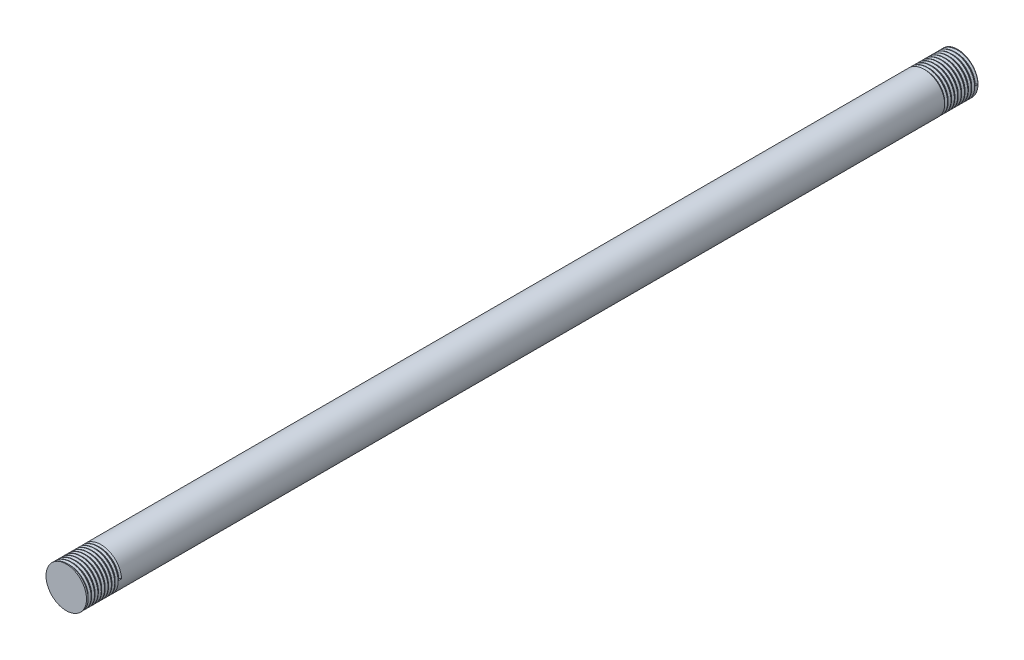
from build123d import *

# Parameters (mm, degrees)
SKETCH1_R           = 7.5
BOSS_EXTRUDE1_DEPTH = 330.2
THREAD4_PITCH       = 1.25
THREAD5_PITCH       = 1.25


with BuildPart() as part:
    # Sketch1 → Boss-Extrude1 (new body)
    with BuildSketch(Plane.XY):
        Circle(SKETCH1_R)
    extrude(amount=BOSS_EXTRUDE1_DEPTH)

    # Thread4: the profile of Thread Profile4 profile screwed along a right-hand helix of 9.5 turns, 8 arcs to a turn; built about Z, then put on its axis
    thread4_z = Axis((0, 0, 0), (0, 0, 1))
    thread4_corners = [(7.5003, 0, -0.000173205), (7.5003, 0, 1.093923202), (6.823417656, 0, 0.703124998), (6.823417656, 0, 0.390624998)]
    with BuildLine(mode=Mode.PRIVATE) as thread4_profile:
        Line(thread4_corners[0], thread4_corners[1])
        Line(thread4_corners[1], thread4_corners[2])
        Line(thread4_corners[2], thread4_corners[3])
        Line(thread4_corners[3], thread4_corners[0])
    thread4_cap = Face(thread4_profile.wire())
    thread4_turn_angles = [0, 22.5, 45, 67.5, 90, 112.5, 135, 157.5, 180, 202.5, 225, 247.5, 270, 292.5, 315, 337.5, 360]
    thread4_turn_weights = [1, 0.9238795325112867, 1, 0.9238795325112867, 1, 0.9238795325112867, 1, 0.9238795325112867, 1, 0.9238795325112867, 1, 0.9238795325112867, 1, 0.9238795325112867, 1, 0.9238795325112867, 1]
    thread4_turn_rails = [Edge.make_bspline([Vector(p[0], p[1], 0).rotate(thread4_z, thread4_turn_angles[k]) / thread4_turn_weights[k] + Vector(0, 0, p[2] + THREAD4_PITCH * thread4_turn_angles[k] / 360) for k in range(17)], [0, 0, 0, 1, 1, 2, 2, 3, 3, 4, 4, 5, 5, 6, 6, 7, 7, 8, 8, 8], 2, thread4_turn_weights) for p in thread4_corners]
    thread4_turn_sides = [Face.make_surface_from_curves(thread4_turn_rails[p[0]], thread4_turn_rails[p[1]]) for p in [(0, 1), (1, 2), (2, 3), (3, 0)]]
    thread4_last_angles = [3240, 3262.5, 3285, 3307.5, 3330, 3352.5, 3375, 3397.5, 3420]
    thread4_last_weights = [1, 0.9238795325112867, 1, 0.9238795325112867, 1, 0.9238795325112867, 1, 0.9238795325112867, 1]
    thread4_last_rails = [Edge.make_bspline([Vector(p[0], p[1], 0).rotate(thread4_z, thread4_last_angles[k]) / thread4_last_weights[k] + Vector(0, 0, p[2] + THREAD4_PITCH * thread4_last_angles[k] / 360) for k in range(9)], [0, 0, 0, 1, 1, 2, 2, 3, 3, 4, 4, 4], 2, thread4_last_weights) for p in thread4_corners]
    thread4_last_sides = [Face.make_surface_from_curves(thread4_last_rails[p[0]], thread4_last_rails[p[1]]) for p in [(0, 1), (1, 2), (2, 3), (3, 0)]]
    thread4 = Plane(origin=(0, 0, 0), x_dir=(1, 0, 0), z_dir=(0, 0, 1)) * Solid(Shell([*[p.moved(Location((0, 0, THREAD4_PITCH * i))) for i in range(9) for p in thread4_turn_sides], *thread4_last_sides, thread4_cap, thread4_cap.rotate(thread4_z, 3420).moved(Location((0, 0, THREAD4_PITCH * 3420 / 360)))]))
    add(thread4, mode=Mode.SUBTRACT)

    # Thread5: the profile of Thread Profile5 profile screwed along a right-hand helix of 9.5 turns, 8 arcs to a turn; built about Z, then put on its axis
    thread5_z = Axis((0, 0, 0), (0, 0, 1))
    thread5_corners = [(7.5003, 0, -0.000173205), (7.5003, 0, 1.093923202), (6.823417656, 0, 0.703124998), (6.823417656, 0, 0.390624998)]
    with BuildLine(mode=Mode.PRIVATE) as thread5_profile:
        Line(thread5_corners[0], thread5_corners[1])
        Line(thread5_corners[1], thread5_corners[2])
        Line(thread5_corners[2], thread5_corners[3])
        Line(thread5_corners[3], thread5_corners[0])
    thread5_cap = Face(thread5_profile.wire())
    thread5_turn_angles = [0, 22.5, 45, 67.5, 90, 112.5, 135, 157.5, 180, 202.5, 225, 247.5, 270, 292.5, 315, 337.5, 360]
    thread5_turn_weights = [1, 0.9238795325112867, 1, 0.9238795325112867, 1, 0.9238795325112867, 1, 0.9238795325112867, 1, 0.9238795325112867, 1, 0.9238795325112867, 1, 0.9238795325112867, 1, 0.9238795325112867, 1]
    thread5_turn_rails = [Edge.make_bspline([Vector(p[0], p[1], 0).rotate(thread5_z, thread5_turn_angles[k]) / thread5_turn_weights[k] + Vector(0, 0, p[2] + THREAD5_PITCH * thread5_turn_angles[k] / 360) for k in range(17)], [0, 0, 0, 1, 1, 2, 2, 3, 3, 4, 4, 5, 5, 6, 6, 7, 7, 8, 8, 8], 2, thread5_turn_weights) for p in thread5_corners]
    thread5_turn_sides = [Face.make_surface_from_curves(thread5_turn_rails[p[0]], thread5_turn_rails[p[1]]) for p in [(0, 1), (1, 2), (2, 3), (3, 0)]]
    thread5_last_angles = [3240, 3262.5, 3285, 3307.5, 3330, 3352.5, 3375, 3397.5, 3420]
    thread5_last_weights = [1, 0.9238795325112867, 1, 0.9238795325112867, 1, 0.9238795325112867, 1, 0.9238795325112867, 1]
    thread5_last_rails = [Edge.make_bspline([Vector(p[0], p[1], 0).rotate(thread5_z, thread5_last_angles[k]) / thread5_last_weights[k] + Vector(0, 0, p[2] + THREAD5_PITCH * thread5_last_angles[k] / 360) for k in range(9)], [0, 0, 0, 1, 1, 2, 2, 3, 3, 4, 4, 4], 2, thread5_last_weights) for p in thread5_corners]
    thread5_last_sides = [Face.make_surface_from_curves(thread5_last_rails[p[0]], thread5_last_rails[p[1]]) for p in [(0, 1), (1, 2), (2, 3), (3, 0)]]
    thread5 = Plane(origin=(0, 0, 330.2), x_dir=(-1, 0, 0), z_dir=(0, 0, -1)) * Solid(Shell([*[p.moved(Location((0, 0, THREAD5_PITCH * i))) for i in range(9) for p in thread5_turn_sides], *thread5_last_sides, thread5_cap, thread5_cap.rotate(thread5_z, 3420).moved(Location((0, 0, THREAD5_PITCH * 3420 / 360)))]))
    add(thread5, mode=Mode.SUBTRACT)


solid = part.part
